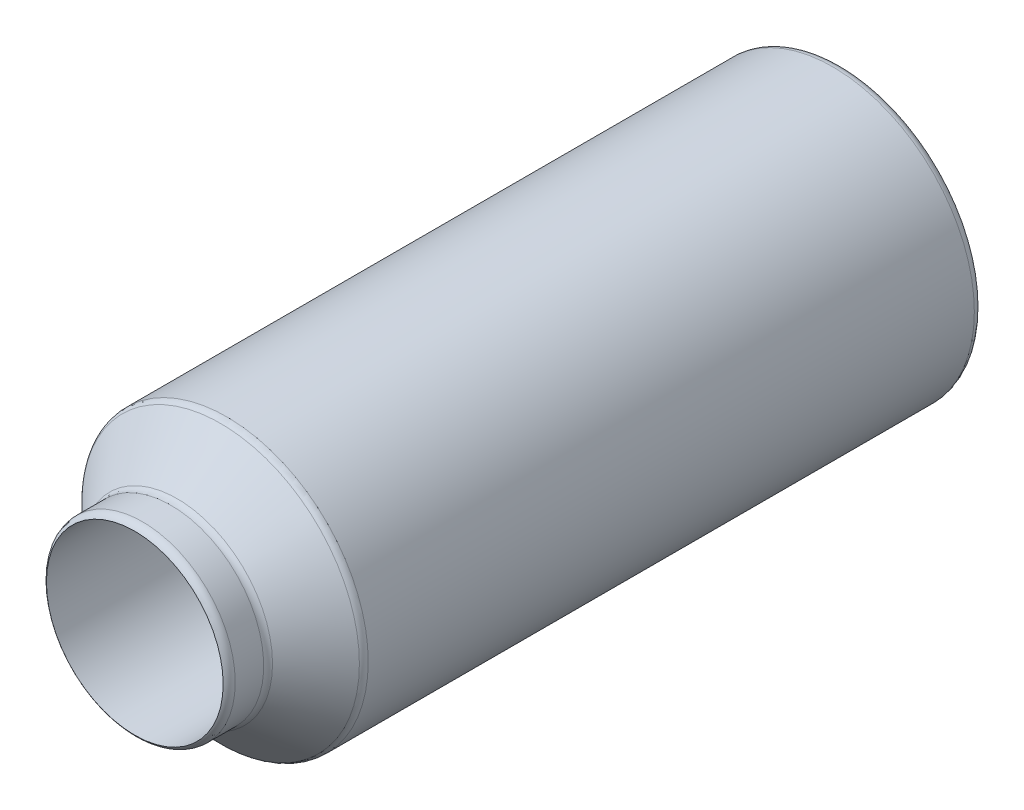
from build123d import *

# Parameters (mm, degrees)
FILLET1_R = 0.5


with BuildPart() as part:
    # Sketch3 → Revolve2 (revolve)
    with BuildSketch(Plane(origin=(0, 0, 0), x_dir=(1, 0, 0), z_dir=(0, 1, 0)), mode=Mode.PRIVATE) as revolve2_sk:
        Polygon((8, 0), (8, -35), (5.25, -37.75), (5.25, -40), (5, -40), (5, 0), align=None)
    revolve(revolve2_sk.sketch.rotate(Axis((0, 0, 0), (0, 0, 1)), 180), axis=Axis((0, 0, 0), (0, 0, 1)))

    # Fillet1
    # the kernel refuses this fillet: 0.5 mm, written as the material it adds along each edge
    with BuildSketch(Plane(origin=(0, 0, 37.75), x_dir=(-1, 0, 0), z_dir=(0, 1, 0))) as fillet1_piece_1:
        with BuildLine():
            CenterArc((5.25 + FILLET1_R, FILLET1_R * 0.414213562373), FILLET1_R, 180, 45)
            Line((5.25, FILLET1_R * 0.414213562373), (5.25, 0))
            Line((5.25, 0), (5.25 + FILLET1_R * 0.292893218813, -FILLET1_R * 0.292893218813))
        make_face()
    revolve(axis=Axis((0, 0, 37.75), (0, 0, 1)))
    # the kernel refuses this fillet: 0.5 mm, written as the material it takes off along each edge
    with BuildSketch(Plane(origin=(0, 0, 0), x_dir=(-1, 0, 0), z_dir=(0, 1, 0))) as fillet1_2_piece_1:
        with BuildLine():
            CenterArc((8 - FILLET1_R, FILLET1_R), FILLET1_R, 270, 90)
            Line((8 - FILLET1_R, 0), (8, 0))
            Line((8, 0), (8, FILLET1_R))
        make_face()
    revolve(axis=Axis((0, 0, 0), (0, 0, 1)), mode=Mode.SUBTRACT)
    with BuildSketch(Plane(origin=(0, 0, 35), x_dir=(-1, 0, 0), z_dir=(0, 1, 0))) as fillet1_2_piece_2:
        with BuildLine():
            CenterArc((8 - FILLET1_R, -FILLET1_R * 0.414213562373), FILLET1_R, 0, 45)
            Line((8 - FILLET1_R * 0.292893218813, FILLET1_R * 0.292893218813), (8, 0))
            Line((8, 0), (8, -FILLET1_R * 0.414213562373))
        make_face()
    revolve(axis=Axis((0, 0, 35), (0, 0, 1)), mode=Mode.SUBTRACT)
    with BuildSketch(Plane(origin=(0, 0, 40), x_dir=(-1, 0, 0), z_dir=(0, 1, 0))) as fillet1_2_piece_3:
        with BuildLine():
            CenterArc((4.75, -0.433012702), FILLET1_R, 0, 60)
            Line((5.25, -0.433012702), (5.25, 0))
            Line((5.25, 0), (5, 0))
        make_face()
    revolve(axis=Axis((0, 0, 40), (0, 0, 1)), mode=Mode.SUBTRACT)
    with BuildSketch(Plane(origin=(0, 0, 0), x_dir=(-1, 0, 0), z_dir=(0, 1, 0))) as fillet1_2_piece_4:
        with BuildLine():
            CenterArc((5 + FILLET1_R, FILLET1_R), FILLET1_R, 180, 90)
            Line((5, FILLET1_R), (5, 0))
            Line((5, 0), (5 + FILLET1_R, 0))
        make_face()
    revolve(axis=Axis((0, 0, 0), (0, 0, 1)), mode=Mode.SUBTRACT)


solid = part.part
